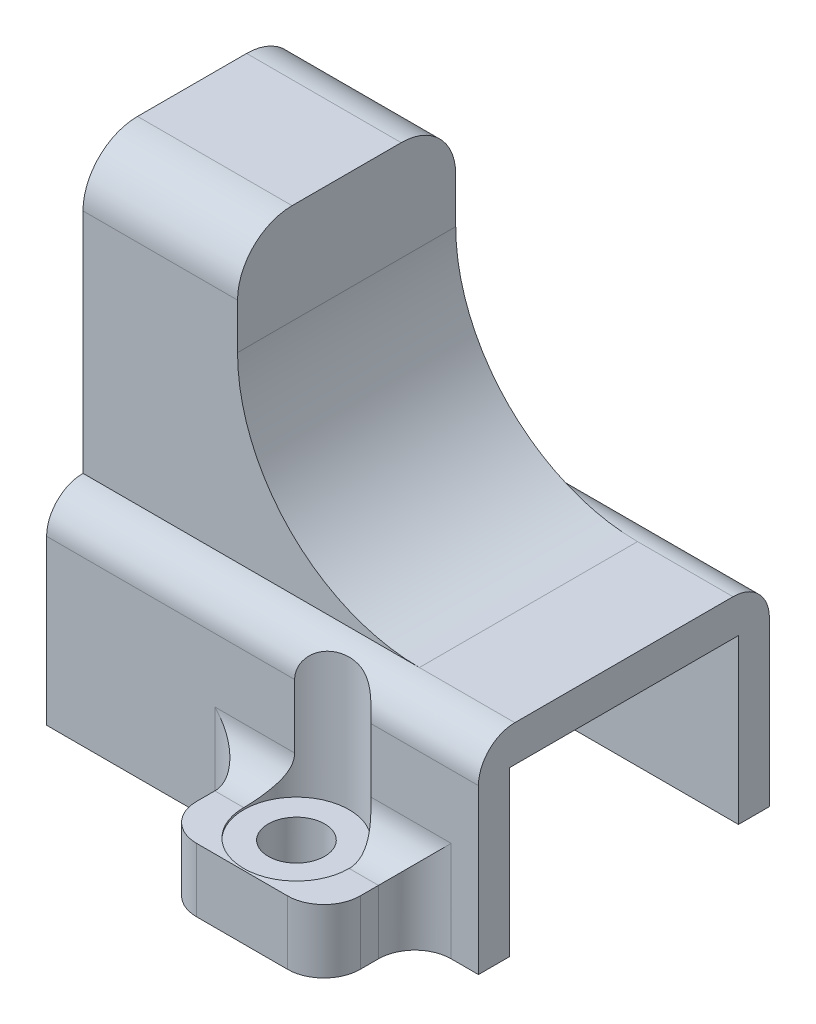
from build123d import *

# Parameters (mm, degrees)
SALIENTE_EXTRUIR1_DEPTH = 10
CORTAR_EXTRUIR1_DEPTH   = 8
CROQUIS3_W              = 9
CROQUIS3_H              = 2.5
SALIENTE_EXTRUIR2_DEPTH = 5
CROQUIS4_R              = 1.5499999999999994
CORTAR_EXTRUIR2_DEPTH   = 2.5
REDONDEO1_R             = 2
CROQUIS5_R              = 2.9
CORTAR_EXTRUIR3_DEPTH   = 7.6
SALIENTE_EXTRUIR3_DEPTH = 15.5
REDONDEO2_R             = 10
REDONDEO3_R             = 3
SALIENTE_EXTRUIR4_DEPTH = 5
CROQUIS8_R              = 1.5499999999999994
SALIENTE_EXTRUIR5_DEPTH = 1


with BuildPart() as part:
    # Croquis1 → Saliente-Extruir1 (new body)
    with BuildSketch(Plane(origin=(0, 0, 0), x_dir=(1, 0, 0), z_dir=(0, 1, 0))):
        Polygon((0, 0), (18.75, 0), (18.749999999999996, 16), (-3.47e-15, 16), align=None)
    extrude(amount=SALIENTE_EXTRUIR1_DEPTH)

    # Croquis2 → Cortar-Extruir1 (cut)
    with BuildSketch(Plane.XZ):
        Polygon((0, -1.7000000000000002), (18.749999999999993, -1.6999999999999997), (18.749999999999996, -14.3), (1.51e-15, -14.3), align=None)
    extrude(amount=-CORTAR_EXTRUIR1_DEPTH, mode=Mode.SUBTRACT)

    # Croquis3 → Saliente-Extruir2 (add)
    with BuildSketch(Plane.XY):
        with Locations((10.750000000000002, 1.25)):
            Rectangle(CROQUIS3_W, CROQUIS3_H)
    extrude(amount=SALIENTE_EXTRUIR2_DEPTH)

    # Croquis4 → Cortar-Extruir2 (cut)
    with BuildSketch(Plane(origin=(0, 2.5, 0), x_dir=(1, 0, 0), z_dir=(0, 1, 0))):
        with Locations(Location((10.74, -2, 0), (0, 0, 270))):
            Circle(CROQUIS4_R)
    extrude(amount=-CORTAR_EXTRUIR2_DEPTH, mode=Mode.SUBTRACT)

    # Redondeo1
    # the kernel refuses this fillet: 2 mm, written as the material it adds along each edge
    with BuildSketch(Plane(origin=(6.25, 2.5, 0), x_dir=(-1, 0, 0), z_dir=(0, -1, 0))) as redondeo1_piece_1:
        with BuildLine():
            CenterArc((REDONDEO1_R, -REDONDEO1_R), REDONDEO1_R, 90, 90)
            Line((0, -REDONDEO1_R), (0, 0))
            Line((0, 0), (REDONDEO1_R, 0))
        make_face()
    extrude(amount=2.5)
    with BuildSketch(Plane(origin=(15.25, 0, 0), x_dir=(1, 0, 0), z_dir=(0, 1, 0))) as redondeo1_piece_2:
        with BuildLine():
            CenterArc((REDONDEO1_R, -REDONDEO1_R), REDONDEO1_R, 90, 90)
            Line((0, -REDONDEO1_R), (0, 0))
            Line((0, 0), (REDONDEO1_R, 0))
        make_face()
    extrude(amount=2.5)
    with BuildSketch(Plane(origin=(15.25, 2.5, 0), x_dir=(0, 1, 0), z_dir=(-1, 0, 0))) as redondeo1_piece_3_section:
        with BuildLine():
            CenterArc((REDONDEO1_R, -REDONDEO1_R), REDONDEO1_R, 90, 90)
            Line((0, -REDONDEO1_R), (0, 0))
            Line((0, 0), (REDONDEO1_R, 0))
        make_face()
    redondeo1_piece_3 = extrude(amount=9, mode=Mode.PRIVATE)
    redondeo1_piece_3 = redondeo1_piece_3 - Plane(origin=(10.74, 2.981912580650479, 2), x_dir=(-1.8e-16, 0, 1), z_dir=(0, 1, 0)) * Cylinder(1.5499999999999994, 26, mode=Mode.PRIVATE)
    add(redondeo1_piece_3)
    with BuildSketch(Plane(origin=(6.25, 7.5, 0), x_dir=(-1, 0, 0), z_dir=(0, -1, 0))) as redondeo1_piece_4a_section:
        with BuildLine():
            CenterArc((REDONDEO1_R, -REDONDEO1_R), REDONDEO1_R, 90, 90)
            Line((0, -REDONDEO1_R), (0, 0))
            Line((0, 0), (REDONDEO1_R, 0))
        make_face()
    redondeo1_piece_4a = extrude(amount=7.5, mode=Mode.PRIVATE)
    redondeo1_piece_4a = split(redondeo1_piece_4a, bisect_by=Plane(origin=(5.797209771466349, 2.5, 0.45279022853365075), z_dir=(0, 1, 0)), keep=Keep.TOP, mode=Mode.PRIVATE)
    with BuildSketch(Plane(origin=(15.25, 2.5, 0), x_dir=(0, 1, 0), z_dir=(-1, 0, 0))) as redondeo1_piece_4b_section:
        with BuildLine():
            CenterArc((REDONDEO1_R, -REDONDEO1_R), REDONDEO1_R, 90, 90)
            Line((0, -REDONDEO1_R), (0, 0))
            Line((0, 0), (REDONDEO1_R, 0))
        make_face()
    redondeo1_piece_4b = extrude(amount=14, mode=Mode.PRIVATE)
    redondeo1_piece_4b = split(redondeo1_piece_4b, bisect_by=Plane(origin=(6.25, 2.952790228533651, 0.45279022853365075), z_dir=(-1, 0, 0)), keep=Keep.TOP, mode=Mode.PRIVATE)
    redondeo1_piece_4 = redondeo1_piece_4a & redondeo1_piece_4b
    add(redondeo1_piece_4)
    with BuildSketch(Plane(origin=(20.25, 2.5, 0), x_dir=(0, 1, 0), z_dir=(-1, 0, 0))) as redondeo1_piece_5a_section:
        with BuildLine():
            CenterArc((REDONDEO1_R, -REDONDEO1_R), REDONDEO1_R, 90, 90)
            Line((0, -REDONDEO1_R), (0, 0))
            Line((0, 0), (REDONDEO1_R, 0))
        make_face()
    redondeo1_piece_5a = extrude(amount=14, mode=Mode.PRIVATE)
    redondeo1_piece_5a = split(redondeo1_piece_5a, bisect_by=Plane(origin=(18.75, 2.952790228533651, 0.45279022853365036), z_dir=(-1, 0, 2.2e-16)), keep=Keep.TOP, mode=Mode.PRIVATE)
    redondeo1_piece_5a = split(redondeo1_piece_5a, bisect_by=Plane(origin=(15.25, 2.952790228533651, 0.45279022853365075), z_dir=(1, 0, 0)), keep=Keep.TOP, mode=Mode.PRIVATE)
    with BuildSketch(Plane(origin=(15.25, 0, 0), x_dir=(1, 0, 0), z_dir=(0, 1, 0))) as redondeo1_piece_5b_section:
        with BuildLine():
            CenterArc((REDONDEO1_R, -REDONDEO1_R), REDONDEO1_R, 90, 90)
            Line((0, -REDONDEO1_R), (0, 0))
            Line((0, 0), (REDONDEO1_R, 0))
        make_face()
    redondeo1_piece_5b = extrude(amount=7.5, mode=Mode.PRIVATE)
    redondeo1_piece_5b = split(redondeo1_piece_5b, bisect_by=Plane(origin=(15.70279022853365, 2.5, 0.45279022853364964), z_dir=(0, 1, 0)), keep=Keep.TOP, mode=Mode.PRIVATE)
    redondeo1_piece_5 = redondeo1_piece_5a & redondeo1_piece_5b
    add(redondeo1_piece_5)
    # the kernel refuses this fillet: 2 mm, written as the material it takes off along each edge
    with BuildSketch(Plane(origin=(23.749999999999996, 10, -16), x_dir=(0, -1, 0), z_dir=(-1, 0, 0))) as redondeo1_2_piece_1:
        with BuildLine():
            CenterArc((REDONDEO1_R, REDONDEO1_R), REDONDEO1_R, 180, 90)
            Line((0, REDONDEO1_R), (0, 0))
            Line((0, 0), (REDONDEO1_R, 0))
        make_face()
    extrude(amount=28.75, mode=Mode.SUBTRACT)
    with BuildSketch(Plane(origin=(6.25, 7.5, 5), x_dir=(0, 0, -1), z_dir=(0, -1, 0))) as redondeo1_2_piece_2:
        with BuildLine():
            CenterArc((REDONDEO1_R, REDONDEO1_R), REDONDEO1_R, 180, 90)
            Line((0, REDONDEO1_R), (0, 0))
            Line((0, 0), (REDONDEO1_R, 0))
        make_face()
    extrude(amount=12.5, mode=Mode.SUBTRACT)
    with BuildSketch(Plane(origin=(15.25, -5, 5), x_dir=(0, 0, -1), z_dir=(0, 1, 0))) as redondeo1_2_piece_3:
        with BuildLine():
            CenterArc((REDONDEO1_R, REDONDEO1_R), REDONDEO1_R, 180, 90)
            Line((0, REDONDEO1_R), (0, 0))
            Line((0, 0), (REDONDEO1_R, 0))
        make_face()
    extrude(amount=12.5, mode=Mode.SUBTRACT)
    with BuildSketch(Plane(origin=(-5, 10, 0), x_dir=(0, -1, 0), z_dir=(1, 0, 0))) as redondeo1_2_piece_4:
        with BuildLine():
            CenterArc((REDONDEO1_R, REDONDEO1_R), REDONDEO1_R, 180, 90)
            Line((0, REDONDEO1_R), (0, 0))
            Line((0, 0), (REDONDEO1_R, 0))
        make_face()
    extrude(amount=28.75, mode=Mode.SUBTRACT)

    # Croquis5 → Cortar-Extruir3 (cut)
    with BuildSketch(Plane(origin=(0, 10, 0), x_dir=(1, 0, 0), z_dir=(0, 1, 0))):
        with Locations(Location((10.74, -2, 0), (0, 0, 270))):
            Circle(CROQUIS5_R)
    extrude(amount=-CORTAR_EXTRUIR3_DEPTH, mode=Mode.SUBTRACT)

    # Croquis6 → Saliente-Extruir3 (add)
    with BuildSketch(Plane(origin=(0, 10, 0), x_dir=(1, 0, 0), z_dir=(0, 1, 0))):
        Polygon((-3.04e-15, 14), (3.499999999999997, 14), (3.4999999999999982, 2), (-3.04e-15, 2), align=None)
    extrude(amount=SALIENTE_EXTRUIR3_DEPTH)

    # Redondeo2
    # the kernel refuses this fillet: 10 mm, written as the material it adds along each edge
    with BuildSketch(Plane(origin=(3.499999999999997, 10, -14), x_dir=(1, 0, -1.1e-16), z_dir=(1.1e-16, 0, 1))) as redondeo2_piece_1:
        with BuildLine():
            CenterArc((REDONDEO2_R, REDONDEO2_R), REDONDEO2_R, 180, 90)
            Line((-2.22e-15, REDONDEO2_R), (0, 0))
            Line((0, 0), (REDONDEO2_R, 0))
        make_face()
    extrude(amount=12)

    # Redondeo3
    redondeo3_edges = [part.edges().sort_by_distance(p)[0] for p in [
        (1.7499999999999976, 25.5, -2),
        (1.749999999999997, 25.5, -14),
    ]]
    fillet(redondeo3_edges, radius=REDONDEO3_R)

    # Croquis7 → Saliente-Extruir4 (add)
    with BuildSketch(Plane.ZY):
        with BuildLine():
            Line((-14.3, 0), (-14.3, 8))
            Line((-14.3, 8), (-1.7000000000000002, 8))
            Line((-1.7000000000000002, 8), (-1.7000000000000002, 0))
            Line((-1.7000000000000002, 0), (0, 0))
            Line((0, 0), (0, 8))
            ThreePointArc((0, 8), (-0.5857864376269049, 9.414213562373096), (-2, 10))
            Line((-2, 10), (-2, 22.500000000000004))
            ThreePointArc((-2, 22.500000000000004), (-2.878679656440357, 24.621320343559645), (-4.999999999999999, 25.500000000000004))
            Line((-4.999999999999999, 25.500000000000004), (-11, 25.500000000000004))
            ThreePointArc((-11, 25.500000000000004), (-13.121320343559642, 24.621320343559645), (-13.999999999999998, 22.500000000000004))
            Line((-13.999999999999998, 22.500000000000004), (-14, 10))
            ThreePointArc((-14, 10), (-15.414213562373096, 9.414213562373096), (-16, 8))
            Line((-16, 8), (-16, 0))
            Line((-16, 0), (-14.3, 0))
        make_face()
    extrude(amount=SALIENTE_EXTRUIR4_DEPTH)

    # Croquis8 → Saliente-Extruir5 (add)
    # profile 1 of 2: a face of its own
    with BuildSketch(Plane.XZ):
        with BuildLine():
            Line((13.25, 5), (8.25, 5))
            ThreePointArc((8.25, 5), (6.835786437626905, 4.414213562373095), (6.25, 3.0000000000000004))
            Line((6.25, 3.0000000000000004), (6.25, 2))
            ThreePointArc((6.25, 2), (5.664213562373095, 0.5857864376269051), (4.25, 0))
            Line((4.25, 0), (-5, 1.08e-15))
            Line((-5, 1.08e-15), (-5, -1.699999999999999))
            Line((-5, -1.699999999999999), (18.749999999999993, -1.6999999999999997))
            Line((18.749999999999993, -1.6999999999999997), (18.75, 0))
            Line((18.75, 0), (17.25, 0))
            ThreePointArc((17.25, 0), (15.835786437626904, 0.5857864376269051), (15.25, 2.0000000000000004))
            Line((15.25, 2.0000000000000004), (15.25, 3))
            ThreePointArc((15.25, 3), (14.664213562373096, 4.414213562373095), (13.25, 5))
        make_face()
        with Locations(Location((10.74, 2, 0), (0, 0, 90))):
            Circle(CROQUIS8_R, mode=Mode.SUBTRACT)
    # profile 2 of 2: a face of its own
    with BuildSketch(Plane.XZ):
        Polygon((18.749999999999996, -14.3), (-5.0000000000000036, -14.299999999999999), (-5.0000000000000036, -16), (18.749999999999996, -16), align=None)
    extrude(amount=SALIENTE_EXTRUIR5_DEPTH)


solid = part.part
